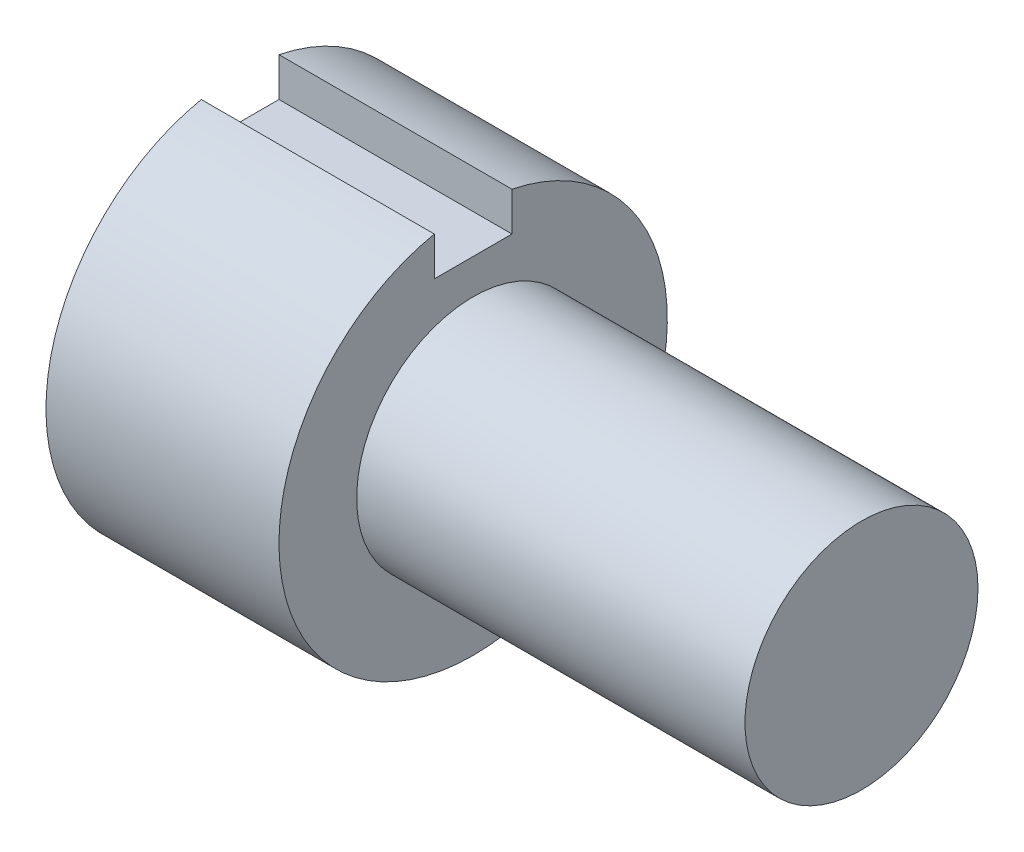
from build123d import *

# Parameters (mm, degrees)
BOSS_EXTRUDE1_OUTLINE_R = 10
BOSS_EXTRUDE1_DEPTH     = 12
SKETCH5_R               = 6
BOSS_EXTRUDE2_DEPTH     = 20
CUT_EXTRUDE1_DEPTH      = 25.494897428


# Read off the part's stored shape, not the designer's step: Boss-Extrude1
with BuildPart() as part:
    # Boss-Extrude1 outline → Boss-Extrude1 (new body)
    with BuildSketch(Plane(origin=(0, 0, 0), x_dir=(0, 0, -1), z_dir=(1, 0, 0))):
        Circle(BOSS_EXTRUDE1_OUTLINE_R)
    extrude(amount=BOSS_EXTRUDE1_DEPTH)

    # Sketch5 → Boss-Extrude2 (add)
    with BuildSketch(Plane(origin=(12, 0, 0), x_dir=(0, 0, -1), z_dir=(1, 0, 0))):
        Circle(SKETCH5_R)
    extrude(amount=BOSS_EXTRUDE2_DEPTH)

    # Sketch7 → Cut-Extrude1 (cut, through all)
    with BuildSketch(Plane(origin=(12, 0, 0), x_dir=(0, 0, -1), z_dir=(1, 0, 0))):
        with BuildLine():
            Line((0, 7.797958971), (2, 7.797958971))
            Line((2, 7.797958971), (2, 9.797958971))
            ThreePointArc((2, 9.797958971), (0, 10), (-2, 9.797958971))
            Line((-2, 9.797958971), (-2, 7.797958971))
            Line((-2, 7.797958971), (0, 7.797958971))
        make_face()
    extrude(amount=-CUT_EXTRUDE1_DEPTH, mode=Mode.SUBTRACT)


solid = part.part
